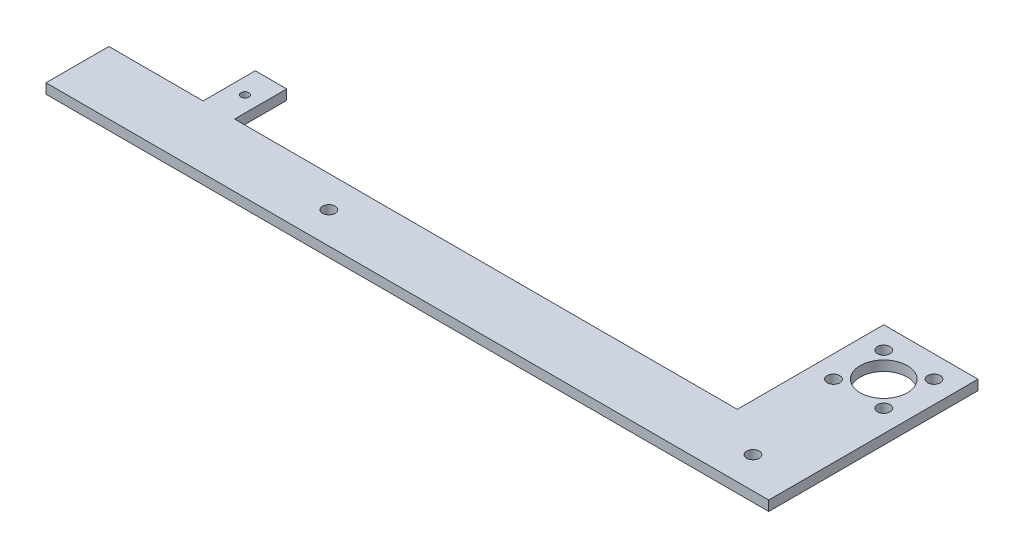
from build123d import *

# Parameters (mm, degrees)
SKETCH1_R           = 1.25
SKETCH1_R_2         = 2
SKETCH1_R_3         = 7.5
BOSS_EXTRUDE1_DEPTH = 3.175


with BuildPart() as part:
    # Sketch1 → Boss-Extrude1 (new body)
    with BuildSketch(Plane(origin=(0, 0, 0), x_dir=(1, 0, 0), z_dir=(0, 1, 0))):
        Polygon((190, -36.6), (190, -26.6), (190, 30), (160, 30), (160, -16.6), (0, -16.6), (0, 0), (-10, 0), (-10, -16.6), (-40, -16.6), (-40, -36.6), align=None)
        with Locations((-5, -8.3)):
            Circle(SKETCH1_R, mode=Mode.SUBTRACT)
        with BuildLine():
            ThreePointArc((38, -26.6), (40, -24.6), (42, -26.6))
            ThreePointArc((42, -26.6), (40, -28.6), (38, -26.6))
        make_face(mode=Mode.SUBTRACT)
        with BuildLine():
            ThreePointArc((173, -26.6), (175, -24.6), (177, -26.6))
            ThreePointArc((177, -26.6), (175, -28.6), (173, -26.6))
        make_face(mode=Mode.SUBTRACT)
        with Locations((167, 23)):
            Circle(SKETCH1_R_2, mode=Mode.SUBTRACT)
        with Locations((167, 7)):
            Circle(SKETCH1_R_2, mode=Mode.SUBTRACT)
        with Locations((183, 7)):
            Circle(SKETCH1_R_2, mode=Mode.SUBTRACT)
        with Locations((183, 23)):
            Circle(SKETCH1_R_2, mode=Mode.SUBTRACT)
        with Locations((175, 15)):
            Circle(SKETCH1_R_3, mode=Mode.SUBTRACT)
    extrude(amount=BOSS_EXTRUDE1_DEPTH)


solid = part.part
